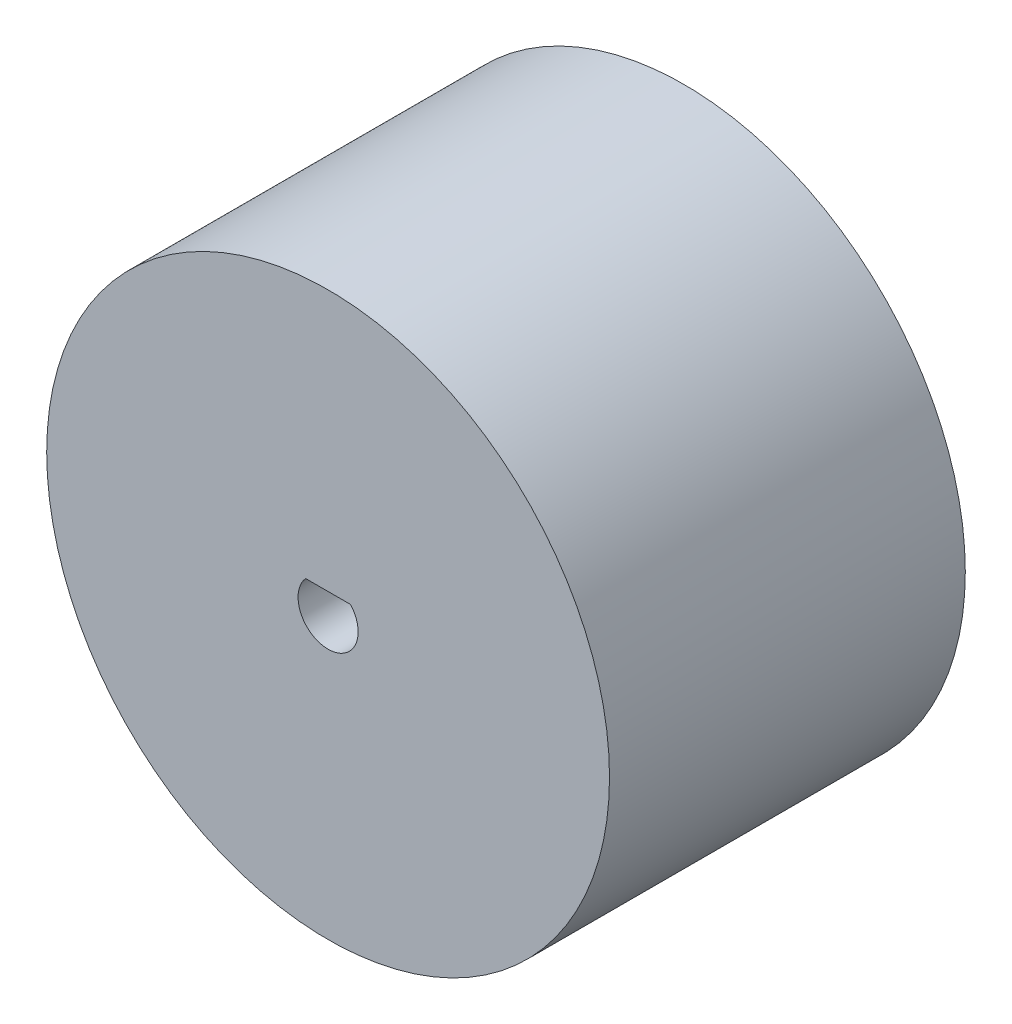
from build123d import *
from build123d.topology import SkipClean

# Parameters (mm, degrees)
CROQUIS2_R              = 14
SALIENTE_EXTRUIR1_DEPTH = 17.7
CORTAR_EXTRUIR1_DEPTH   = 10
VACIADO4_OUTLINE_R      = 13
VACIADO4_DEPTH          = 16.7
VACIADO4_2_DEPTH        = 6.7
CORTAR_EXTRUIR5_DEPTH   = 10


# Read off the part's stored shape, not the designer's step: Vaciado4
with BuildPart() as part:
    # Croquis2 → Saliente-Extruir1 (new body)
    with BuildSketch(Plane.XY):
        Circle(CROQUIS2_R)
    extrude(amount=SALIENTE_EXTRUIR1_DEPTH)

    # Croquis3 → Cortar-Extruir1 (cut)
    with BuildSketch(Plane.XY.offset(17.7)):
        with BuildLine():
            Line((1.118033989, 1), (-1.118033989, 1))
            ThreePointArc((-1.118033989, 1), (0, -1.48785271), (1.118033989, 1))
        make_face()
    extrude(amount=-CORTAR_EXTRUIR1_DEPTH, mode=Mode.SUBTRACT)

    # Vaciado4 outline → Vaciado4 (cut)
    with BuildSketch(Plane.XY):
        Circle(VACIADO4_OUTLINE_R)
        with BuildLine():
            ThreePointArc((1.501626665, 2), (0, -2.48785271), (-1.501626665, 2))
            Line((-1.501626665, 2), (1.501626665, 2))
        make_face(mode=Mode.SUBTRACT)
    extrude(amount=VACIADO4_DEPTH, mode=Mode.SUBTRACT)

    # Vaciado4 2 outline → Vaciado4 2 (cut)
    with BuildSketch(Plane.XY):
        with BuildLine():
            Line((1.501626665, 2), (-1.501626665, 2))
            ThreePointArc((-1.501626665, 2), (0, -2.48785271), (1.501626665, 2))
        make_face()
    extrude(amount=VACIADO4_2_DEPTH, mode=Mode.SUBTRACT)

    # Croquis5 → Cortar-Extruir5 (cut)
    with SkipClean():  # the faces are left unmerged after this step: merging them gives an invalid solid
        with BuildSketch(Plane.XY.offset(7.7)):
            with BuildLine():
                Line((-1.118033989, 1), (1.118033989, 1))
                ThreePointArc((1.118033989, 1), (0, -1.48785271), (-1.118033989, 1))
            make_face()
        extrude(amount=-CORTAR_EXTRUIR5_DEPTH, mode=Mode.SUBTRACT)


solid = part.part
